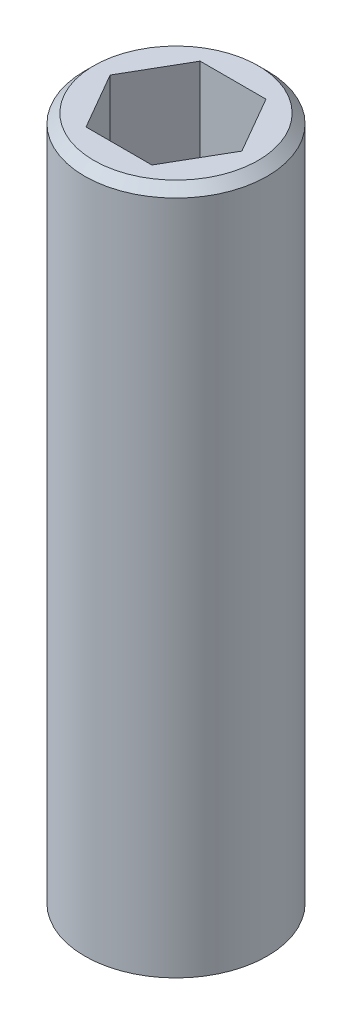
from build123d import *

# Parameters (mm, degrees)
SKETCH1_R           = 2
BOSS_EXTRUDE1_DEPTH = 7.5
CUT_EXTRUDE1_DEPTH  = 2
CHAMFER1_SIZE       = 0.2


with BuildPart() as part:
    # Sketch1 → Boss-Extrude1 (new, symmetric)
    with BuildSketch(Plane(origin=(0, 0, 0), x_dir=(1, 0, 0), z_dir=(0, 1, 0))):
        Circle(SKETCH1_R)
    extrude(amount=BOSS_EXTRUDE1_DEPTH, both=True)

    # Sketch2 → Cut-Extrude1 (cut)
    with BuildSketch(Plane(origin=(0, 7.5, 0), x_dir=(1, 0, 0), z_dir=(0, 1, 0))):
        Polygon((0.721687836, 1.25), (-0.721687836, 1.25), (-1.443375673, 0), (-0.721687836, -1.25), (0.721687836, -1.25), (1.443375673, 0), align=None)
    extrude(amount=-CUT_EXTRUDE1_DEPTH, mode=Mode.SUBTRACT)

    # Chamfer1
    chamfer1_edges = [part.edges().sort_by_distance(p)[0] for p in [
        (-2, 7.5, 0),
    ]]
    chamfer(chamfer1_edges, length=CHAMFER1_SIZE)


solid = part.part
